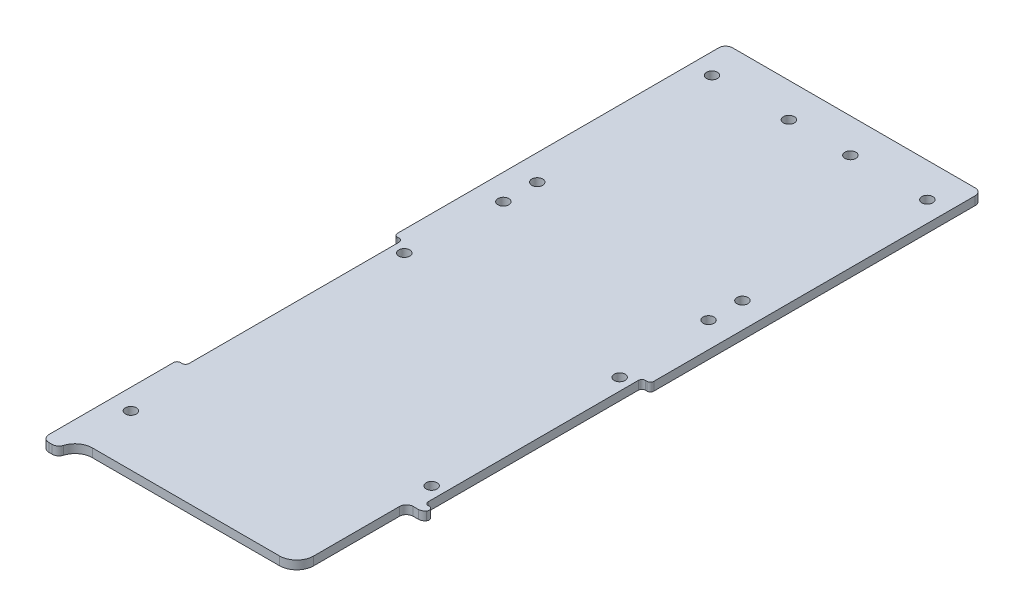
from build123d import *

# Parameters (mm, degrees)
SKETCH1_R               = 2.032
BOSS_EXTRUDE1_DEPTH     = 3.175
FILLET1_R               = 2.54
FILLET2_R               = 2.54
FILLET3_R               = 6.35
CUT_EXTRUDE1_DEPTH      = 136.673215063
FILLET4_R               = 6.35
FILLET5_R               = 2.54
SKETCH3_R               = 2.032
CUT_EXTRUDE2_DEPTH      = 136.673215063
CUT_EXTRUDE3_DEPTH      = 136.673215063
CUT_EXTRUDE3_DEPTH_BACK = 136.673215063
SKETCH4_W               = 3.175
SKETCH4_H               = 80.645
FILLET6_R               = 1.27


with BuildPart() as part:
    # Sketch1 → Boss-Extrude1 (new body)
    with BuildSketch(Plane(origin=(0, 0, 0), x_dir=(1, 0, 0), z_dir=(0, 1, 0))):
        Polygon((47.625, 127), (-47.625, 127), (-47.625, -127), (-41.275, -127), (-41.275, -120.65), (41.275, -120.65), (41.275, -127), (47.625, -127), align=None)
        with Locations((-39.999684148, -101.6)):
            Circle(SKETCH1_R, mode=Mode.SUBTRACT)
        with Locations((39.999684148, -69.85)):
            Circle(SKETCH1_R, mode=Mode.SUBTRACT)
        with Locations((-39.999684148, 0)):
            Circle(SKETCH1_R, mode=Mode.SUBTRACT)
        with Locations((-39.999684148, 114.3)):
            Circle(SKETCH1_R, mode=Mode.SUBTRACT)
        with Locations((-11.424684148, 114.3)):
            Circle(SKETCH1_R, mode=Mode.SUBTRACT)
        with Locations((39.999684148, 0)):
            Circle(SKETCH1_R, mode=Mode.SUBTRACT)
        with Locations((11.424684148, 114.3)):
            Circle(SKETCH1_R, mode=Mode.SUBTRACT)
        with Locations((39.999684148, 114.3)):
            Circle(SKETCH1_R, mode=Mode.SUBTRACT)
    extrude(amount=BOSS_EXTRUDE1_DEPTH)

    # Fillet1
    fillet1_edges = [part.edges().sort_by_distance(p)[0] for p in [
        (-47.625, 1.5875, -127),
        (47.625, 1.5875, -127),
        (47.625, 1.5875, 127),
        (-47.625, 1.5875, 127),
    ]]
    fillet(fillet1_edges, radius=FILLET1_R)

    # Fillet2
    fillet2_edges = [part.edges().sort_by_distance(p)[0] for p in [
        (41.275, 1.5875, 127),
        (-41.275, 1.5875, 127),
    ]]
    fillet(fillet2_edges, radius=FILLET2_R)

    # Fillet3
    fillet3_edges = [part.edges().sort_by_distance(p)[0] for p in [
        (41.275, 1.5875, 120.65),
        (-41.275, 1.5875, 120.65),
    ]]
    fillet(fillet3_edges, radius=FILLET3_R)

    # Sketch2 → Cut-Extrude1 (cut, through all)
    with BuildSketch(Plane.XZ):
        with BuildLine():
            Line((40.64508, 123.578690235), (40.64508, 79.88808))
            Line((40.64508, 79.88808), (47.625, 79.88808))
            Line((47.625, 79.88808), (47.625, 124.46))
            ThreePointArc((47.625, 124.46), (46.881051224, 126.256051224), (45.085, 127))
            Line((45.085, 127), (43.815, 127))
            ThreePointArc((43.815, 127), (42.297059666, 126.496530663), (41.380880287, 125.185714286))
            ThreePointArc((41.380880287, 125.185714286), (41.069166069, 124.356476684), (40.64508, 123.578690235))
        make_face()
    extrude(amount=-CUT_EXTRUDE1_DEPTH, mode=Mode.SUBTRACT)

    # Fillet4
    fillet4_edges = [part.edges().sort_by_distance(p)[0] for p in [
        (40.64508, 1.5875, 123.578690235),
    ]]
    fillet(fillet4_edges, radius=FILLET4_R)

    # Fillet5
    fillet5_edges = [part.edges().sort_by_distance(p)[0] for p in [
        (47.625, 1.5875, 79.88808),
        (40.64508, 1.5875, 79.88808),
    ]]
    fillet(fillet5_edges, radius=FILLET5_R)

    # Sketch3 → Cut-Extrude2 (cut, through all)
    with BuildSketch(Plane.XZ):
        with Locations((-38.108301122, -34.913768806)):
            Circle(SKETCH3_R)
        with Locations((-38.108301122, -47.490173279)):
            Circle(SKETCH3_R)
        with Locations((38.108301122, -47.490173279)):
            Circle(SKETCH3_R)
        with Locations((38.108301122, -34.913768806)):
            Circle(SKETCH3_R)
    extrude(amount=-CUT_EXTRUDE2_DEPTH, mode=Mode.SUBTRACT)

    # Sketch4 → Cut-Extrude3 (cut, two sides: drawn at the far end of the back side and taken through both)
    with BuildSketch(Plane(origin=(0, 3.175, 0), x_dir=(1, 0, 0), z_dir=(0, 1, 0)).offset(-CUT_EXTRUDE3_DEPTH_BACK)):
        with Locations((-46.0375, -36.5125)):
            Rectangle(SKETCH4_W, SKETCH4_H)
        with Locations((46.0375, -36.5125)):
            Rectangle(SKETCH4_W, SKETCH4_H)
    extrude(amount=CUT_EXTRUDE3_DEPTH + CUT_EXTRUDE3_DEPTH_BACK, mode=Mode.SUBTRACT)

    # Fillet6
    fillet6_edges = [part.edges().sort_by_distance(p)[0] for p in [
        (-44.45, 1.5875, -3.81),
        (-47.625, 1.5875, -3.81),
        (-47.625, 1.5875, 76.835),
        (-44.45, 1.5875, 76.835),
        (44.45, 1.5875, 76.835),
        (47.625, 1.5875, 76.835),
        (44.45, 1.5875, -3.81),
        (47.625, 1.5875, -3.81),
    ]]
    fillet(fillet6_edges, radius=FILLET6_R)


solid = part.part
